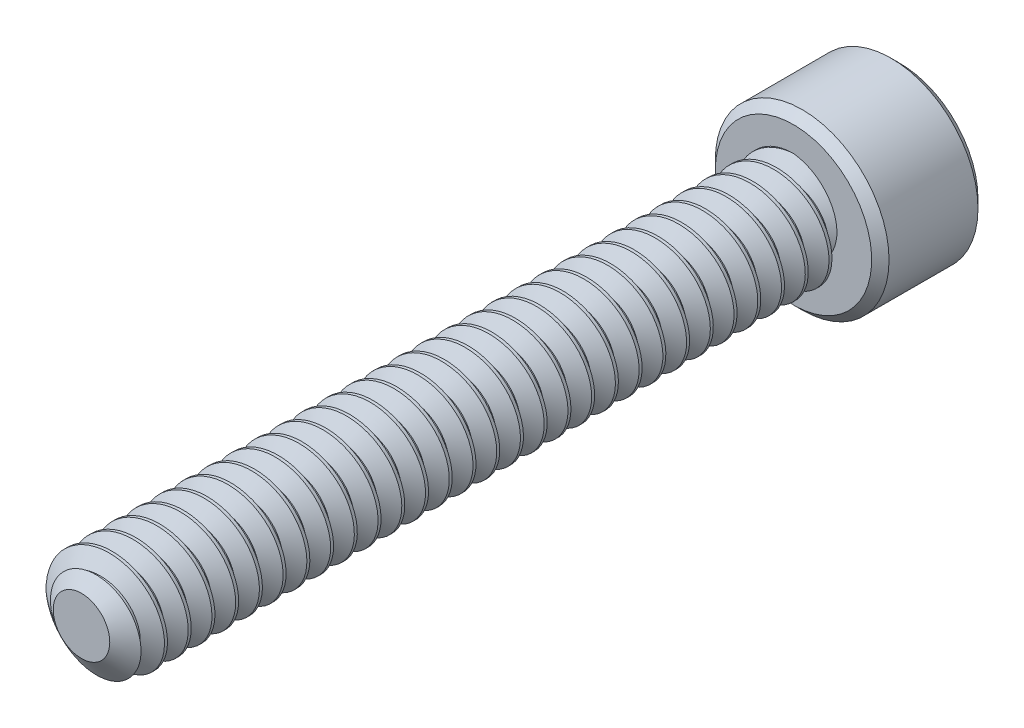
from build123d import *

# Parameters (mm, degrees)
SKETCH1_R          = 1.4224
EXTRUDE1_DEPTH     = 19.05
CUT_SWEEP1_PITCH   = 0.635
SKETCH6_R          = 2.3241
EXTRUDE2_DEPTH     = 2.8448
CUT_EXTRUDE1_DEPTH = 1.7859375
CHAMFER1_SIZE      = 0.23241


with BuildPart() as part:
    # Sketch1 → Extrude1 (new body)
    with BuildSketch(Plane.XY):
        Circle(SKETCH1_R)
    extrude(amount=-EXTRUDE1_DEPTH)

    # Cut-Sweep1: arcs per turn and ends read off the stored shape
    # Cut-Sweep1: the profile of Sketch3 profile screwed along a right-hand helix through 33 turns, 6 arcs to a turn; built about Z, then put on its axis
    cut_sweep1_z = Axis((0, 0, 0), (0, 0, 1))
    cut_sweep1_corners = [(1.4227, 0, -1.190798205), (1.009955401, 0, -0.9525), (1.009955401, 0, -0.873125), (1.4227, 0, -0.634826795)]
    with BuildLine(mode=Mode.PRIVATE) as cut_sweep1_profile:
        Line(cut_sweep1_corners[0], cut_sweep1_corners[1])
        Line(cut_sweep1_corners[1], cut_sweep1_corners[2])
        Line(cut_sweep1_corners[2], cut_sweep1_corners[3])
        Line(cut_sweep1_corners[3], cut_sweep1_corners[0])
    cut_sweep1_cap = Face(cut_sweep1_profile.wire())
    cut_sweep1_turn_angles = [0, 30, 60, 90, 120, 150, 180, 210, 240, 270, 300, 330, 360]
    cut_sweep1_turn_weights = [1, 0.8660254037844387, 1, 0.8660254037844387, 1, 0.8660254037844387, 1, 0.8660254037844387, 1, 0.8660254037844387, 1, 0.8660254037844387, 1]
    cut_sweep1_turn_rails = [Edge.make_bspline([Vector(p[0], p[1], 0).rotate(cut_sweep1_z, cut_sweep1_turn_angles[k]) / cut_sweep1_turn_weights[k] + Vector(0, 0, p[2] + CUT_SWEEP1_PITCH * cut_sweep1_turn_angles[k] / 360) for k in range(13)], [0, 0, 0, 1, 1, 2, 2, 3, 3, 4, 4, 5, 5, 6, 6, 6], 2, cut_sweep1_turn_weights) for p in cut_sweep1_corners]
    cut_sweep1_turn_sides = [Face.make_surface_from_curves(cut_sweep1_turn_rails[p[0]], cut_sweep1_turn_rails[p[1]]) for p in [(0, 1), (1, 2), (2, 3), (3, 0)]]
    cut_sweep1 = Plane(origin=(0, 0, 0), x_dir=(0, 1, 0), z_dir=(0, 0, -1)) * Solid(Shell([*[p.moved(Location((0, 0, CUT_SWEEP1_PITCH * i))) for i in range(33) for p in cut_sweep1_turn_sides], cut_sweep1_cap, cut_sweep1_cap.rotate(cut_sweep1_z, 11880).moved(Location((0, 0, CUT_SWEEP1_PITCH * 11880 / 360)))]))
    add(cut_sweep1, mode=Mode.SUBTRACT)

    # Sketch4 → Cut-Revolve1 (revolve, cut)
    with BuildSketch(Plane(origin=(0, 0, 0), x_dir=(0, 0, -1), z_dir=(1, 0, 0)), mode=Mode.PRIVATE) as cut_revolve1_sk:
        Polygon((0.466649532, 1.4224), (0, 0.755955401), (0, 1.4224), align=None)
    revolve(cut_revolve1_sk.sketch.rotate(Axis((0, 0, 0), (0, 0, -1)), 264.795368264), axis=Axis((0, 0, 0), (0, 0, -1)), mode=Mode.SUBTRACT)

    # Sketch6 → Extrude2 (add)
    with BuildSketch(Plane(origin=(0, 0, -19.05), x_dir=(-1, 0, 0), z_dir=(0, 0, -1))):
        Circle(SKETCH6_R)
    extrude(amount=EXTRUDE2_DEPTH)

    # Sketch7 → Cut-Extrude1 (cut)
    with BuildSketch(Plane(origin=(0, 0, -21.8948), x_dir=(-1, 0, 0), z_dir=(0, 0, -1))):
        Polygon((0, 1.374815329), (-1.190625, 0.687407664), (-1.190625, -0.687407664), (0, -1.374815329), (1.190625, -0.687407664), (1.190625, 0.687407664), align=None)
    extrude(amount=-CUT_EXTRUDE1_DEPTH, mode=Mode.SUBTRACT)

    # Cut-Extrude2 cone 1 section (through the dimple's axis) → Cut-Extrude2 (revolve, cut)
    with BuildSketch(Plane(origin=(0, 0, -21.8948), x_dir=(0, 1, 0), z_dir=(1, 0, 0))):
        Polygon((0, 0), (1.374815329, 0), (0, 1.374815329), align=None)
    revolve(axis=Axis((0, 0, -21.8948), (0, 0, 1)), mode=Mode.SUBTRACT)

    # Chamfer1
    chamfer1_edges = [part.edges().sort_by_distance(p)[0] for p in [
        (2.3241, 0, -19.05),
        (2.3241, 0, -21.8948),
    ]]
    chamfer(chamfer1_edges, length=CHAMFER1_SIZE)


solid = part.part
